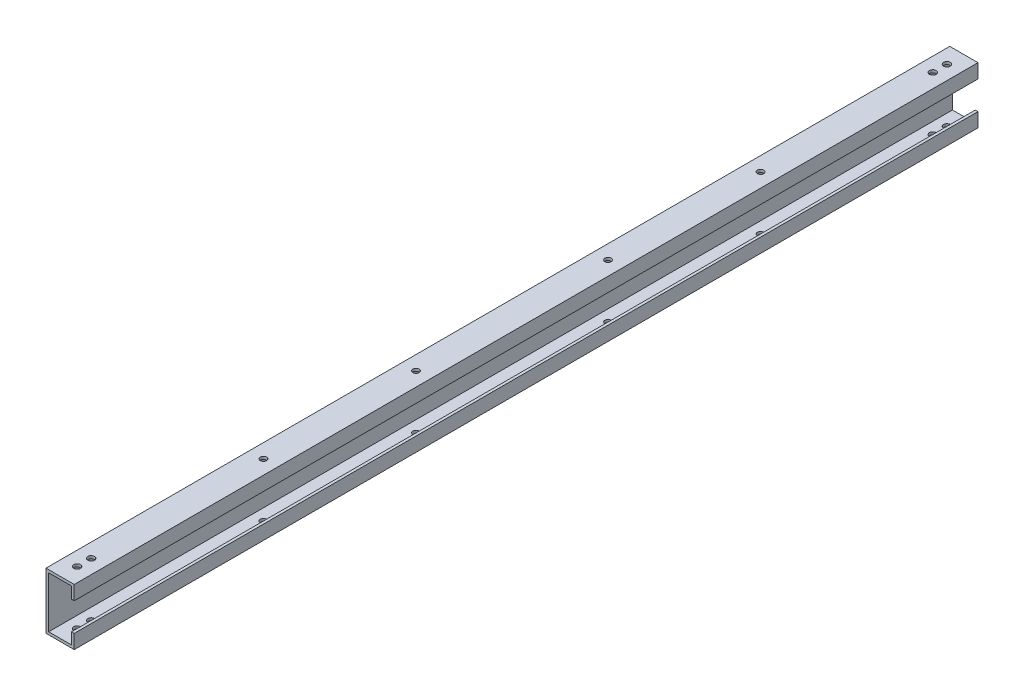
from build123d import *

# Parameters (mm, degrees)
CROQUIS1_W                         = 50
CROQUIS1_H                         = 100
CROQUIS1_W_2                       = 40.475
CROQUIS1_H_2                       = 90.475
SALIENTE_EXTRUIR1_DEPTH            = 800
CROQUIS2_W                         = 1600
CROQUIS2_H                         = 50
CORTAR_EXTRUIR1_DEPTH              = 5
TALADRO_DE_MARGEN_PARA_7_161_D     = 11.90498
TALADRO_DE_MARGEN_PARA_7_161_DEPTH = 151.5
TALADRO_DE_MARGEN_PARA_7_161_TIP   = 3.576616826
TALADRO_DE_MARGEN_PARA_7_162_D     = 11.90498
TALADRO_DE_MARGEN_PARA_7_162_DEPTH = 151.5
TALADRO_DE_MARGEN_PARA_7_162_TIP   = 3.576616826
CROQUIS13_R                        = 5.55625
CORTAR_EXTRUIR2_DEPTH              = 120


with BuildPart() as part:
    # Croquis1 → Saliente-Extruir1 (new, symmetric)
    with BuildSketch(Plane.XY):
        Rectangle(CROQUIS1_W, CROQUIS1_H)
        Rectangle(CROQUIS1_W_2, CROQUIS1_H_2, mode=Mode.SUBTRACT)
    extrude(amount=SALIENTE_EXTRUIR1_DEPTH, both=True)

    # Croquis2 → Cortar-Extruir1 (cut)
    with BuildSketch(Plane(origin=(25, 0, 0), x_dir=(0, 0, -1), z_dir=(1, 0, 0))):
        Rectangle(CROQUIS2_W, CROQUIS2_H)
    extrude(amount=-CORTAR_EXTRUIR1_DEPTH, mode=Mode.SUBTRACT)

    # Taladro de margen para 7/161
    with Locations(Plane(origin=(349.311711603, -55.2375, 12.24117116), x_dir=(-1, 0, 0), z_dir=(0, -1, 0))):
        with Locations((-600.688288397, 757.24117116), (-600.688288397, 782.24117116), (349.311711603, 782.24117116), (349.311711603, 757.24117116)):
            Hole(TALADRO_DE_MARGEN_PARA_7_161_D / 2, depth=TALADRO_DE_MARGEN_PARA_7_161_DEPTH)
            with Locations((0, 0, -(TALADRO_DE_MARGEN_PARA_7_161_DEPTH + TALADRO_DE_MARGEN_PARA_7_161_TIP / 2))):  # 118° drill point
                Cone(0, TALADRO_DE_MARGEN_PARA_7_161_D / 2, TALADRO_DE_MARGEN_PARA_7_161_TIP, mode=Mode.SUBTRACT)

    # Taladro de margen para 7/162
    with Locations(Plane(origin=(600.688288397, -55.2375, -12.24117116), x_dir=(1, 0, 0), z_dir=(0, -1, 0))):
        with Locations((-600.688288397, 757.24117116), (-600.688288397, 782.24117116), (349.311711603, 782.24117116), (349.311711603, 757.24117116)):
            Hole(TALADRO_DE_MARGEN_PARA_7_162_D / 2, depth=TALADRO_DE_MARGEN_PARA_7_162_DEPTH)
            with Locations((0, 0, -(TALADRO_DE_MARGEN_PARA_7_162_DEPTH + TALADRO_DE_MARGEN_PARA_7_162_TIP / 2))):  # 118° drill point
                Cone(0, TALADRO_DE_MARGEN_PARA_7_162_D / 2, TALADRO_DE_MARGEN_PARA_7_162_TIP, mode=Mode.SUBTRACT)

    # Croquis13 → Cortar-Extruir2 (cut)
    with BuildSketch(Plane.XZ.offset(50)):
        with Locations((0, -440)):
            Circle(CROQUIS13_R)
        with Locations((0, -170)):
            Circle(CROQUIS13_R)
        with Locations((0, 440)):
            Circle(CROQUIS13_R)
        with Locations((0, 170)):
            Circle(CROQUIS13_R)
    extrude(amount=-CORTAR_EXTRUIR2_DEPTH, mode=Mode.SUBTRACT)


solid = part.part
